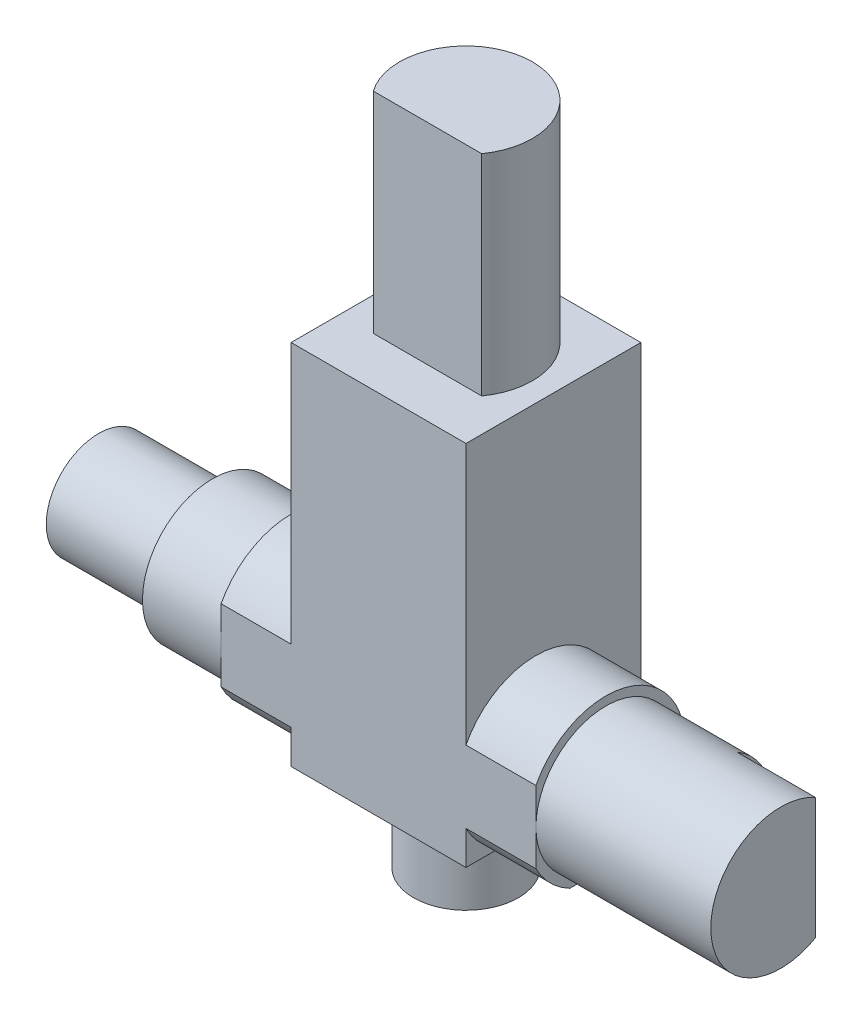
from build123d import *

# Parameters (mm, degrees)
SKETCH1_R            = 1.5
BOSS_EXTRUDE1_DEPTH  = 2
SKETCH2_R            = 2
BOSS_EXTRUDE2_DEPTH  = 0.5
SKETCH3_W            = 5
SKETCH3_H            = 5
BOSS_EXTRUDE3_DEPTH  = 10.5
SKETCH4_R            = 1.9
BOSS_EXTRUDE4_DEPTH  = 3.5
BOSS_EXTRUDE5_DEPTH  = 2.5
BOSS_EXTRUDE9_DEPTH  = 2
SKETCH8_R            = 2
BOSS_EXTRUDE10_DEPTH = 5
BOSS_EXTRUDE12_START = -3.5
BOSS_EXTRUDE12_DEPTH = 3.5
CUT_EXTRUDE1_START   = -3.5
CUT_EXTRUDE1_DEPTH   = 3.5
CUT_EXTRUDE4_START   = -2.25
CUT_EXTRUDE4_DEPTH   = 2.25
SKETCH14_R           = 2
SKETCH14_R_2         = 1.5
CUT_EXTRUDE5_DEPTH   = 3.25
BOSS_EXTRUDE13_START = 0.5
SKETCH15_R           = 2
SKETCH15_R_2         = 1.5
BOSS_EXTRUDE13_DEPTH = 0.5
BOSS_EXTRUDE14_START = 0.5
SKETCH17_R           = 1.5
BOSS_EXTRUDE14_DEPTH = 0.5


# Read off the part's stored shape, not the designer's step: Cut-Extrude4
with BuildPart() as part:
    # Sketch1 → Boss-Extrude1 (new body)
    with BuildSketch(Plane(origin=(0, 0, 0), x_dir=(1, 0, 0), z_dir=(0, 1, 0))):
        with Locations(Location((0, 0, 0), (0, 0, 270))):
            Circle(SKETCH1_R)
    extrude(amount=BOSS_EXTRUDE1_DEPTH)

    # Sketch2 → Boss-Extrude2 (add)
    with BuildSketch(Plane(origin=(0, 2, 0), x_dir=(1, 0, 0), z_dir=(0, 1, 0))):
        with Locations(Location((0, 0, 0), (0, 0, 270))):
            Circle(SKETCH2_R)
    extrude(amount=BOSS_EXTRUDE2_DEPTH)

    # Sketch3 → Boss-Extrude3 (add)
    with BuildSketch(Plane(origin=(0, 2.5, 0), x_dir=(1, 0, 0), z_dir=(0, 1, 0))):
        Rectangle(SKETCH3_W, SKETCH3_H)
    extrude(amount=BOSS_EXTRUDE3_DEPTH)

    # Sketch4 → Boss-Extrude4 (add)
    with BuildSketch(Plane(origin=(0, 13, 0), x_dir=(1, 0, 0), z_dir=(0, 1, 0))):
        with Locations(Location((0, 0, 0), (0, 0, 270))):
            Circle(SKETCH4_R)
    extrude(amount=BOSS_EXTRUDE4_DEPTH)

    # Sketch5 → Boss-Extrude5 (add)
    with BuildSketch(Plane(origin=(0, 16.5, 0), x_dir=(1, 0, 0), z_dir=(0, 1, 0))):
        with BuildLine():
            Line((1.549193338, -1.1), (-1.549193338, -1.1))
            ThreePointArc((-1.549193338, -1.1), (0, 1.9), (1.549193338, -1.1))
        make_face()
    extrude(amount=BOSS_EXTRUDE5_DEPTH)

    # Sketch7 → Boss-Extrude9 (add)
    with BuildSketch(Plane(origin=(2.5, 0, 0), x_dir=(0, 0, -1), z_dir=(1, 0, 0))):
        with BuildLine():
            ThreePointArc((-2.5, 3.469223594), (-2.090990258, 2.909009742), (-1.530776406, 2.5))
            Line((-1.530776406, 2.5), (0.530776406, 2.5))
            ThreePointArc((0.530776406, 2.5), (1.090990258, 6.090990258), (-2.5, 5.530776406))
            Line((-2.5, 5.530776406), (-2.5, 3.469223594))
        make_face()
    boss_extrude9 = extrude(amount=BOSS_EXTRUDE9_DEPTH)

    # Sketch8 → Boss-Extrude10 (add)
    with BuildSketch(Plane(origin=(4.5, 0, 0), x_dir=(0, 0, -1), z_dir=(1, 0, 0))):
        with Locations(Location((-0.5, 4.5, 0), (0, 0, 180))):
            Circle(SKETCH8_R)
    boss_extrude10 = extrude(amount=BOSS_EXTRUDE10_DEPTH)

    # Mirror1: Boss-Extrude9, Boss-Extrude10 across plane
    add(boss_extrude9.mirror(Plane(origin=(0, 0, 0), x_dir=(0, 0, 1), z_dir=(1, 0, 0))))
    add(boss_extrude10.mirror(Plane(origin=(0, 0, 0), x_dir=(0, 0, 1), z_dir=(1, 0, 0))))

    # Sketch10 → Boss-Extrude12 (add)
    with BuildSketch(Plane(origin=(0, 16.5, 0), x_dir=(1, 0, 0), z_dir=(0, 1, 0)).offset(BOSS_EXTRUDE12_START)):
        with BuildLine():
            ThreePointArc((-1.549193338, -1.1), (0, -1.9), (1.549193338, -1.1))
            Line((1.549193338, -1.1), (-1.549193338, -1.1))
        make_face()
    extrude(amount=BOSS_EXTRUDE12_DEPTH)

    # Sketch11 → Cut-Extrude1 (cut)
    with BuildSketch(Plane(origin=(0, 16.5, 0), x_dir=(1, 0, 0), z_dir=(0, 1, 0)).offset(CUT_EXTRUDE1_START)):
        with BuildLine():
            Line((-1.549193338, -1.1), (1.549193338, -1.1))
            ThreePointArc((1.549193338, -1.1), (0, -1.9), (-1.549193338, -1.1))
        make_face()
    extrude(amount=CUT_EXTRUDE1_DEPTH, mode=Mode.SUBTRACT)

    # Cut-Extrude4 outline → Cut-Extrude4 (cut)
    with BuildSketch(Plane(origin=(9.5, 0, 0), x_dir=(0, 0, -1), z_dir=(1, 0, 0)).offset(CUT_EXTRUDE4_START)):
        with BuildLine():
            ThreePointArc((0.5, 2.767949192), (1.5, 4.5), (0.5, 6.232050808))
            Line((0.5, 6.232050808), (0.5, 2.767949192))
        make_face()
    extrude(amount=CUT_EXTRUDE4_DEPTH, mode=Mode.SUBTRACT)

    # Sketch14 → Cut-Extrude5 (cut)
    with BuildSketch(Plane.ZY.offset(9.5)):
        with Locations((0.5, 4.5)):
            Circle(SKETCH14_R)
        with Locations((0.5, 4.5)):
            Circle(SKETCH14_R_2, mode=Mode.SUBTRACT)
    extrude(amount=-CUT_EXTRUDE5_DEPTH, mode=Mode.SUBTRACT)

    # Sketch15 → Boss-Extrude13 (add)
    with BuildSketch(Plane.ZY.offset(6.25).offset(BOSS_EXTRUDE13_START)):
        with Locations((0.5, 4.5)):
            Circle(SKETCH15_R)
        with Locations((0.5, 4.5)):
            Circle(SKETCH15_R_2, mode=Mode.SUBTRACT)
    extrude(amount=-BOSS_EXTRUDE13_DEPTH)

    # Sketch17 → Boss-Extrude14 (add)
    with BuildSketch(Plane.ZY.offset(9.5).offset(BOSS_EXTRUDE14_START)):
        with Locations((0.5, 4.5)):
            Circle(SKETCH17_R)
    extrude(amount=-BOSS_EXTRUDE14_DEPTH)


solid = part.part
